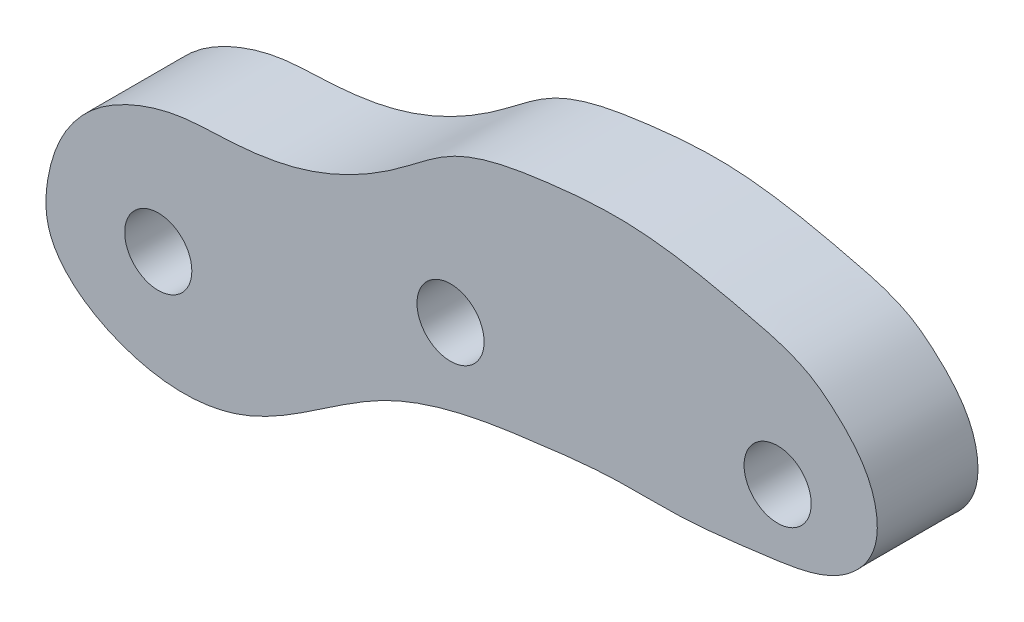
from build123d import *

# Parameters (mm, degrees)
BOSS_EXTRUDE1_DEPTH = 3
CUT_EXTRUDE1_REACH  = 29.576
SKETCH2_R           = 1


with BuildPart() as part:
    # Sketch1 → Boss-Extrude1 (new body)
    with BuildSketch(Plane.XY):
        with BuildLine():
            add(Edge.make_bspline(
                [(-22.328411118, 8.32191579), (-22.249295906, 8.800738876), (-21.959799378, 9.71996668), (-21.062245525, 10.825395232), (-19.812607599, 11.55799923), (-18.408811853, 11.98105053), (-16.727402499, 11.983578828), (-14.430179381, 12.298066385), (-12.231728659, 13.455082505), (-10.138811299, 15.243715812), (-7.672718232, 15.687232056), (-4.660032268, 15.9527052), (-1.970731633, 15.384172579), (0.192641063, 14.830329224), (1.365482149, 13.871409901), (2.316593326, 12.808528877), (2.526862602, 11.050741654), (1.151858455, 9.561099028), (-1.026338057, 9.297540589), (-3.278771897, 8.987733886), (-5.556537123, 9.072867931), (-7.516893251, 8.834612714), (-9.806553457, 8.530362169), (-12.159286488, 7.877270185), (-14.415847026, 6.279681212), (-16.7728733, 4.795902598), (-19.826487317, 4.693716832), (-22.479209568, 6.340536006), (-22.392010822, 7.936996046), (-22.328411118, 8.32191579)],
                knots=[0, 0, 0, 0, 0.02470813, 0.049748928, 0.071753101, 0.09921537, 0.12474973, 0.158825954, 0.21872713, 0.250841394, 0.300066985, 0.344426797, 0.407962815, 0.442242596, 0.457873906, 0.486028054, 0.51498594, 0.539924379, 0.582497663, 0.624525888, 0.659072151, 0.700276303, 0.726900911, 0.779345733, 0.824521432, 0.87049488, 0.920590492, 0.980137451, 1, 1, 1, 1], degree=3))
        make_face()
    extrude(amount=BOSS_EXTRUDE1_DEPTH)

    # Sketch2 → Cut-Extrude1 (cut, up to next)
    with BuildSketch(Plane.XY.offset(3), mode=Mode.PRIVATE) as cut_extrude1_sk1:
        with Locations((-19.038421265, 8.097031644)):
            Circle(SKETCH2_R)
    cut_extrude1_tool1 = extrude(cut_extrude1_sk1.sketch, amount=-CUT_EXTRUDE1_REACH, mode=Mode.PRIVATE) & part.part
    # Sketch2 → Cut-Extrude1 (cut, up to next)
    with BuildSketch(Plane.XY.offset(3), mode=Mode.PRIVATE) as cut_extrude1_sk2:
        with Locations((-10.331496509, 10.621301417)):
            Circle(SKETCH2_R)
    cut_extrude1_tool2 = extrude(cut_extrude1_sk2.sketch, amount=-CUT_EXTRUDE1_REACH, mode=Mode.PRIVATE) & part.part
    # Sketch2 → Cut-Extrude1 (cut, up to next)
    with BuildSketch(Plane.XY.offset(3), mode=Mode.PRIVATE) as cut_extrude1_sk3:
        with Locations((-0.587732205, 11.315827256)):
            Circle(SKETCH2_R)
    cut_extrude1_tool3 = extrude(cut_extrude1_sk3.sketch, amount=-CUT_EXTRUDE1_REACH, mode=Mode.PRIVATE) & part.part
    add(cut_extrude1_tool1.solids().sort_by_distance((-19.038421, 8.097032, 3))[0], mode=Mode.SUBTRACT)
    add(cut_extrude1_tool2.solids().sort_by_distance((-10.331497, 10.621301, 3))[0], mode=Mode.SUBTRACT)
    add(cut_extrude1_tool3.solids().sort_by_distance((-0.587732, 11.315827, 3))[0], mode=Mode.SUBTRACT)


solid = part.part
